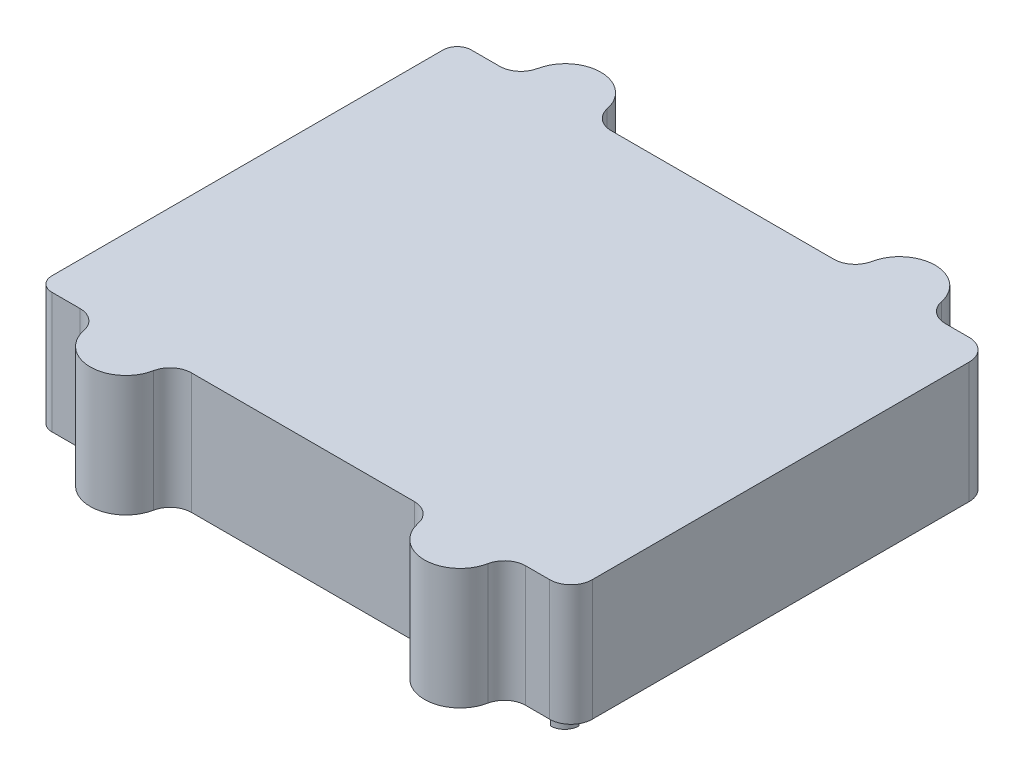
from build123d import *

# Parameters (mm, degrees)
SKETCH1_W            = 75
SKETCH1_H            = 59
BOSS_EXTRUDE1_DEPTH  = 17
SKETCH2_W            = 70.030390533
SKETCH2_H            = 54.863609995
CUT_EXTRUDE1_DEPTH   = 14.5
FILLET2_R            = 2
FILLET3_R            = 2
FILLET4_R            = 3
FILLET5_R            = 3
FILLET6_R            = 2
FILLET7_R            = 2
SKETCH3_W            = 16.063867443
SKETCH3_H            = 6.760736642
SKETCH3_W_2          = 17.298229076
BOSS_EXTRUDE4_DEPTH  = 1.5
SKETCH4_W            = 16.053106641
SKETCH4_H            = 5.652521888
BOSS_EXTRUDE5_DEPTH  = 1.5
SKETCH5_R            = 5
BOSS_EXTRUDE7_DEPTH  = 17
FILLET8_R            = 3
FILLET9_R            = 3
FILLET10_R           = 3
FILLET11_R           = 3
FILLET12_R           = 3
FILLET13_R           = 3
FILLET14_R           = 3
FILLET15_R           = 3
SKETCH8_R            = 3.4
BOSS_EXTRUDE8_DEPTH  = 2
SKETCH9_W            = 12.808706793
SKETCH9_H            = 4.429846096
CUT_EXTRUDE2_DEPTH   = 2
FILLET16_R           = 2
SKETCH10_W           = 13.5
SKETCH10_H           = 12.5
CUT_EXTRUDE3_DEPTH   = 93.639080666
SKETCH12_R           = 3.015343742
SKETCH12_R_2         = 3.061200892
BOSS_EXTRUDE9_DEPTH  = 2.5
SKETCH13_W           = 14.232082031
SKETCH13_H           = 6.597089722
CUT_EXTRUDE5_DEPTH   = 2
SKETCH14_W           = 10.206840338
SKETCH14_H           = 7.342462146
CUT_EXTRUDE6_DEPTH   = 2
SKETCH15_W           = 11.301995552
SKETCH15_H           = 4.624503131
CUT_EXTRUDE7_DEPTH   = 2
SKETCH17_W           = 12.439796887
SKETCH17_H           = 13.014402488
CUT_EXTRUDE8_DEPTH   = 0.8
SKETCH20_W           = 2.355031091
SKETCH20_H           = 13.45969072
CUT_EXTRUDE9_DEPTH   = 10
SKETCH24_W           = 16.053106641
SKETCH24_H           = 5.652521888
CUT_EXTRUDE10_DEPTH  = 1.5
SKETCH25_W           = 17.298229076
SKETCH25_H           = 6.760736642
CUT_EXTRUDE11_DEPTH  = 1.5
SKETCH26_W           = 16.063867443
SKETCH26_H           = 6.760736642
CUT_EXTRUDE12_DEPTH  = 1.5
SKETCH27_W           = 10.245109275
SKETCH27_H           = 5.404900878
SKETCH27_W_2         = 8.945643237
SKETCH27_H_2         = 7.064717813
CUT_EXTRUDE15_DEPTH  = 1.5
SKETCH29_W           = 59.670840593
SKETCH29_H           = 9.824746357
CUT_EXTRUDE23_DEPTH  = 2.5
SKETCH30_W           = 2.58437015
SKETCH30_H           = 3.605163566
SKETCH30_W_2         = 3.229261283
BOSS_EXTRUDE10_DEPTH = 1.5
BOSS_EXTRUDE12_DEPTH = 17
BOSS_EXTRUDE13_DEPTH = 17
FILLET25_R           = 1
FILLET26_R           = 1


with BuildPart() as part:
    # Sketch1 → Boss-Extrude1 (new body)
    with BuildSketch(Plane(origin=(0, 0, 0), x_dir=(1, 0, 0), z_dir=(0, 1, 0))):
        with Locations((-51.300737228, -19.00715852)):
            Rectangle(SKETCH1_W, SKETCH1_H)
    extrude(amount=BOSS_EXTRUDE1_DEPTH)

    # Sketch2 → Cut-Extrude1 (cut)
    with BuildSketch(Plane(origin=(0, 0, 0), x_dir=(-1, 0, 0), z_dir=(0, -1, 0))):
        with Locations((51.436785652, -19.347434848)):
            Rectangle(SKETCH2_W, SKETCH2_H)
    extrude(amount=-CUT_EXTRUDE1_DEPTH, mode=Mode.SUBTRACT)

    # Fillet2
    fillet2_edges = [part.edges().sort_by_distance(p)[0] for p in [
        (-16.421590385, 7.25, -8.08437015),
    ]]
    fillet(fillet2_edges, radius=FILLET2_R)

    # Fillet3
    fillet3_edges = [part.edges().sort_by_distance(p)[0] for p in [
        (-16.421590385, 7.25, 46.779239845),
    ]]
    fillet(fillet3_edges, radius=FILLET3_R)

    # Fillet4
    fillet4_edges = [part.edges().sort_by_distance(p)[0] for p in [
        (-13.800737228, 8.5, -10.49284148),
    ]]
    fillet(fillet4_edges, radius=FILLET4_R)

    # Fillet5
    fillet5_edges = [part.edges().sort_by_distance(p)[0] for p in [
        (-13.800737228, 8.5, 48.50715852),
    ]]
    fillet(fillet5_edges, radius=FILLET5_R)

    # Fillet6
    fillet6_edges = [part.edges().sort_by_distance(p)[0] for p in [
        (-88.800737228, 8.5, -10.49284148),
    ]]
    fillet(fillet6_edges, radius=FILLET6_R)

    # Fillet7
    fillet7_edges = [part.edges().sort_by_distance(p)[0] for p in [
        (-88.800737228, 8.5, 48.50715852),
    ]]
    fillet(fillet7_edges, radius=FILLET7_R)

    # Sketch3 → Boss-Extrude4 (add)
    with BuildSketch(Plane.XY.offset(-8.08437015)):
        with Locations((-26.453524107, 1.054300918)):
            Rectangle(SKETCH3_W, SKETCH3_H)
        with Locations((-77.80286638, 1.054300918)):
            Rectangle(SKETCH3_W_2, SKETCH3_H)
    extrude(amount=BOSS_EXTRUDE4_DEPTH)

    # Sketch4 → Boss-Extrude5 (add)
    with BuildSketch(Plane(origin=(0, 0, 46.779239845), x_dir=(-1, 0, 0), z_dir=(0, 0, -1))):
        with Locations((55.103314843, -0.060708267)):
            Rectangle(SKETCH4_W, SKETCH4_H)
    extrude(amount=BOSS_EXTRUDE5_DEPTH)

    # Sketch5 → Boss-Extrude7 (add)
    with BuildSketch(Plane(origin=(0, 17, 0), x_dir=(1, 0, 0), z_dir=(0, 1, 0))):
        with Locations((-75, 11.89284148)):
            Circle(SKETCH5_R)
        with Locations((-28, 11.89284148)):
            Circle(SKETCH5_R)
        with Locations((-28, -49.90715852)):
            Circle(SKETCH5_R)
        with Locations((-75, -49.90715852)):
            Circle(SKETCH5_R)
    extrude(amount=-BOSS_EXTRUDE7_DEPTH)

    # Fillet8
    fillet8_edges = [part.edges().sort_by_distance(p)[0] for p in [
        (-32.8, 8.5, 48.50715852),
    ]]
    fillet(fillet8_edges, radius=FILLET8_R)

    # Fillet9
    fillet9_edges = [part.edges().sort_by_distance(p)[0] for p in [
        (-23.2, 8.5, 48.50715852),
    ]]
    fillet(fillet9_edges, radius=FILLET9_R)

    # Fillet10
    fillet10_edges = [part.edges().sort_by_distance(p)[0] for p in [
        (-32.8, 8.5, -10.49284148),
    ]]
    fillet(fillet10_edges, radius=FILLET10_R)

    # Fillet11
    fillet11_edges = [part.edges().sort_by_distance(p)[0] for p in [
        (-23.2, 8.5, -10.49284148),
    ]]
    fillet(fillet11_edges, radius=FILLET11_R)

    # Fillet12
    fillet12_edges = [part.edges().sort_by_distance(p)[0] for p in [
        (-70.2, 8.5, -10.49284148),
    ]]
    fillet(fillet12_edges, radius=FILLET12_R)

    # Fillet13
    fillet13_edges = [part.edges().sort_by_distance(p)[0] for p in [
        (-79.8, 8.5, -10.49284148),
    ]]
    fillet(fillet13_edges, radius=FILLET13_R)

    # Fillet14
    fillet14_edges = [part.edges().sort_by_distance(p)[0] for p in [
        (-79.8, 8.5, 48.50715852),
    ]]
    fillet(fillet14_edges, radius=FILLET14_R)

    # Fillet15
    fillet15_edges = [part.edges().sort_by_distance(p)[0] for p in [
        (-70.2, 8.5, 48.50715852),
    ]]
    fillet(fillet15_edges, radius=FILLET15_R)

    # Sketch8 → Boss-Extrude8 (add)
    with BuildSketch(Plane(origin=(0, 14.5, 0), x_dir=(-1, 0, 0), z_dir=(0, -1, 0))):
        with Locations((70.451980918, -43.4)):
            Circle(SKETCH8_R)
    extrude(amount=BOSS_EXTRUDE8_DEPTH)

    # Sketch9 → Cut-Extrude2 (cut)
    with BuildSketch(Plane(origin=(0, 0, 46.779239845), x_dir=(-1, 0, 0), z_dir=(0, 0, -1))):
        with Locations((73.926541466, 10.587695891)):
            Rectangle(SKETCH9_W, SKETCH9_H)
    extrude(amount=CUT_EXTRUDE2_DEPTH, mode=Mode.SUBTRACT)

    # Fillet16
    # the kernel refuses this fillet: 2 mm, written as the material it takes off along each edge
    with BuildSketch(Plane(origin=(-75, 8.372772843, 49.90715852), x_dir=(0.9477649598196841, 0, 0.31896956114650243), z_dir=(-0.31896956114650243, 0, 0.9477649598196841))) as fillet16_piece_1_section:
        with BuildLine():
            CenterArc((5 - FILLET16_R, -FILLET16_R), FILLET16_R, 0, 90)
            Line((5 - FILLET16_R, 0), (5, 0))
            Line((5, 0), (5, -FILLET16_R))
        make_face()
    fillet16_piece_1 = revolve(axis=Axis((-75, 8.372772843, 49.90715852), (0, 1, 0)), revolution_arc=217.20123952, mode=Mode.PRIVATE)
    fillet16_piece_1 = split(fillet16_piece_1, bisect_by=Plane(origin=(-75, 7.75577909, 46.779239845), z_dir=(0, 0, -1)), keep=Keep.TOP, mode=Mode.PRIVATE)
    add(fillet16_piece_1, mode=Mode.SUBTRACT)

    # Sketch10 → Cut-Extrude3 (cut, through all)
    with BuildSketch(Plane(origin=(-86.451980918, 0, 0), x_dir=(0, 0, -1), z_dir=(1, 0, 0))):
        with Locations((-31.029239845, 6.358142349)):
            Rectangle(SKETCH10_W, SKETCH10_H)
    extrude(amount=-CUT_EXTRUDE3_DEPTH, mode=Mode.SUBTRACT)

    # Sketch12 → Boss-Extrude9 (add)
    with BuildSketch(Plane.XZ.offset(-12.5)):
        with Locations(Location((-19.451980918, 28.340005887, 0), (0, 0, 270))):
            Circle(SKETCH12_R)
        with Locations((-19.451980918, 1.240005887)):
            Circle(SKETCH12_R_2)
    extrude(amount=-BOSS_EXTRUDE9_DEPTH)

    # Sketch13 → Cut-Extrude5 (cut)
    with BuildSketch(Plane(origin=(0, 0, 46.779239845), x_dir=(-1, 0, 0), z_dir=(0, 0, -1))):
        with Locations((28.532879783, 11.201455139)):
            Rectangle(SKETCH13_W, SKETCH13_H)
    extrude(amount=CUT_EXTRUDE5_DEPTH, mode=Mode.SUBTRACT)

    # Sketch14 → Cut-Extrude6 (cut)
    with BuildSketch(Plane.XY.offset(-8.08437015)):
        with Locations((-28.337854921, 10.828768927)):
            Rectangle(SKETCH14_W, SKETCH14_H)
    extrude(amount=CUT_EXTRUDE6_DEPTH, mode=Mode.SUBTRACT)

    # Sketch15 → Cut-Extrude7 (cut)
    with BuildSketch(Plane.XY.offset(-8.08437015)):
        with Locations((-75.453181284, 12.187748435)):
            Rectangle(SKETCH15_W, SKETCH15_H)
    extrude(amount=CUT_EXTRUDE7_DEPTH, mode=Mode.SUBTRACT)

    # Sketch17 → Cut-Extrude8 (cut)
    with BuildSketch(Plane(origin=(-86.451980918, 0, 0), x_dir=(0, 0, -1), z_dir=(1, 0, 0))):
        with Locations((-0.822624341, 6.507201244)):
            Rectangle(SKETCH17_W, SKETCH17_H)
    extrude(amount=-CUT_EXTRUDE8_DEPTH, mode=Mode.SUBTRACT)

    # Sketch20 → Cut-Extrude9 (cut)
    with BuildSketch(Plane.XZ):
        with Locations((-87.623221683, 31.019256527)):
            Rectangle(SKETCH20_W, SKETCH20_H)
    extrude(amount=-CUT_EXTRUDE9_DEPTH, mode=Mode.SUBTRACT)

    # Sketch24 → Cut-Extrude10 (cut)
    with BuildSketch(Plane(origin=(0, 0, 45.279239845), x_dir=(-1, 0, 0), z_dir=(0, 0, -1))):
        with Locations((55.103314843, -0.060708267)):
            Rectangle(SKETCH24_W, SKETCH24_H)
    extrude(amount=-CUT_EXTRUDE10_DEPTH, mode=Mode.SUBTRACT)

    # Sketch25 → Cut-Extrude11 (cut)
    with BuildSketch(Plane.XY.offset(-6.58437015)):
        with Locations((-77.80286638, 1.054300918)):
            Rectangle(SKETCH25_W, SKETCH25_H)
    extrude(amount=-CUT_EXTRUDE11_DEPTH, mode=Mode.SUBTRACT)

    # Sketch26 → Cut-Extrude12 (cut)
    with BuildSketch(Plane.XY.offset(-6.58437015)):
        with Locations((-26.453524107, 1.054300918)):
            Rectangle(SKETCH26_W, SKETCH26_H)
    extrude(amount=-CUT_EXTRUDE12_DEPTH, mode=Mode.SUBTRACT)

    # Sketch27 → Cut-Extrude15 (cut)
    with BuildSketch(Plane.XY.offset(-8.08437015)):
        with Locations((-28.244157388, 6.012393954)):
            Rectangle(SKETCH27_W, SKETCH27_H)
        with Locations((-74.691547802, 7.280418696)):
            Rectangle(SKETCH27_W_2, SKETCH27_H_2)
    extrude(amount=CUT_EXTRUDE15_DEPTH, mode=Mode.SUBTRACT)

    # Sketch29 → Cut-Extrude23 (cut)
    with BuildSketch(Plane(origin=(0, 0, 46.779239845), x_dir=(-1, 0, 0), z_dir=(0, 0, -1))):
        with Locations((52.407440491, 4.047505326)):
            Rectangle(SKETCH29_W, SKETCH29_H)
    extrude(amount=CUT_EXTRUDE23_DEPTH, mode=Mode.SUBTRACT)

    # Sketch30 → Boss-Extrude10 (add)
    with BuildSketch(Plane(origin=(-86.451980918, 0, 0), x_dir=(0, 0, -1), z_dir=(1, 0, 0))):
        with Locations((6.792185075, 0.129538017)):
            Rectangle(SKETCH30_W, SKETCH30_H)
        with Locations((-45.164609204, 0.129538017)):
            Rectangle(SKETCH30_W_2, SKETCH30_H)
    extrude(amount=BOSS_EXTRUDE10_DEPTH)

    # Sketch33 → Boss-Extrude12 (add)
    with BuildSketch(Plane.XZ.offset(-14.5)):
        with BuildLine():
            Line((-18.421590385, 46.779239845), (-18.421590385, 44.779239845))
            Line((-18.421590385, 44.779239845), (-16.421590385, 44.779239845))
            ThreePointArc((-16.421590385, 44.779239845), (-17.007376823, 46.193453407), (-18.421590385, 46.779239845))
        make_face()
    extrude(amount=BOSS_EXTRUDE12_DEPTH)

    # Sketch34 → Boss-Extrude13 (add)
    with BuildSketch(Plane(origin=(0, 14.5, 0), x_dir=(-1, 0, 0), z_dir=(0, -1, 0))):
        with BuildLine():
            Line((16.421590385, 6.08437015), (18.421590385, 6.08437015))
            Line((18.421590385, 6.08437015), (18.421590385, 8.08437015))
            ThreePointArc((18.421590385, 8.08437015), (17.007376823, 7.498583712), (16.421590385, 6.08437015))
        make_face()
    extrude(amount=BOSS_EXTRUDE13_DEPTH)

    # Fillet25
    fillet25_edges = [part.edges().sort_by_distance(p)[0] for p in [
        (-18.421590385, 6, -6.08437015),
    ]]
    fillet(fillet25_edges, radius=FILLET25_R)

    # Fillet26
    fillet26_edges = [part.edges().sort_by_distance(p)[0] for p in [
        (-18.421590385, 6, 44.779239845),
    ]]
    fillet(fillet26_edges, radius=FILLET26_R)


solid = part.part
